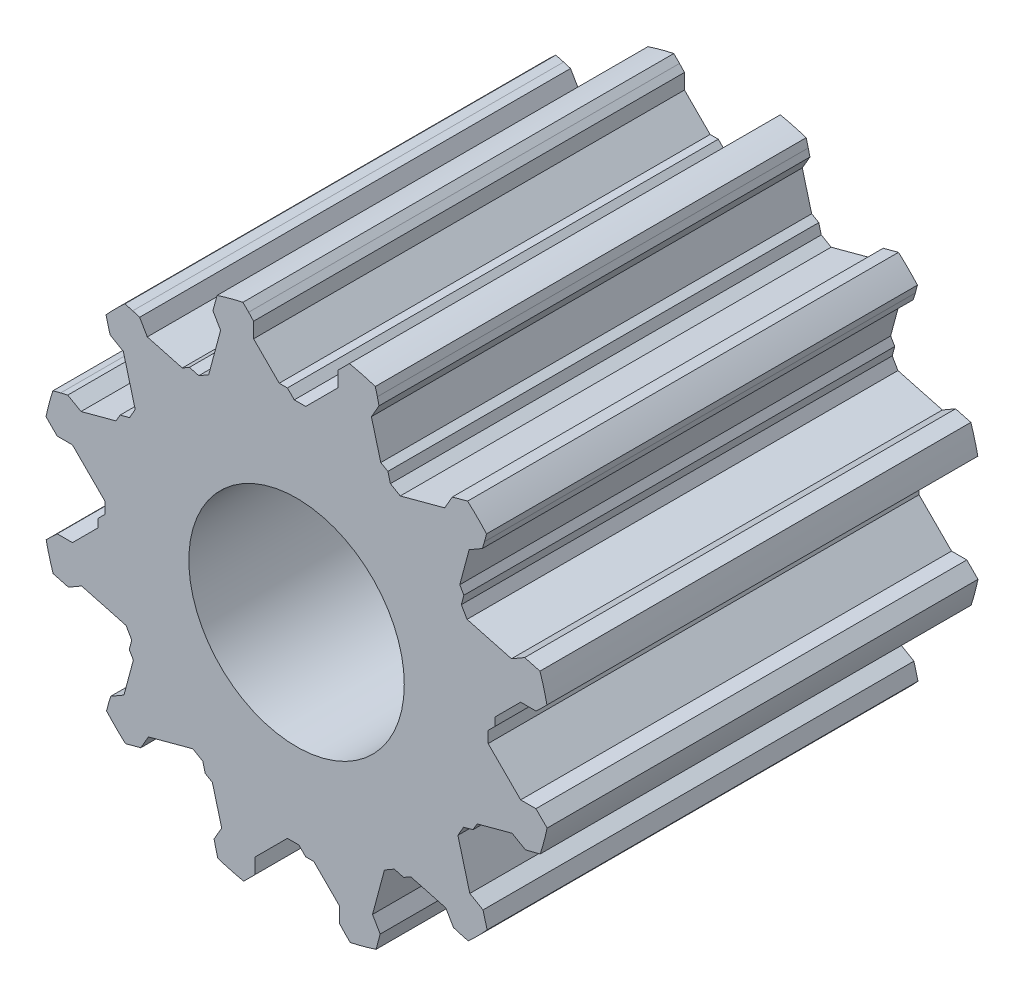
from build123d import *

# Parameters (mm, degrees)
SKETCH1_R           = 3.565718634
SKETCH1_R_2         = 1.5
BOSS_EXTRUDE1_DEPTH = 6
CUT_EXTRUDE2_DEPTH  = 6.2
CIRPATTERN1_COUNT   = 12


with BuildPart() as part:
    # Sketch1 → Boss-Extrude1 (new body)
    with BuildSketch(Plane.XY):
        Circle(SKETCH1_R)
        Circle(SKETCH1_R_2, mode=Mode.SUBTRACT)
    extrude(amount=BOSS_EXTRUDE1_DEPTH)

    # Sketch2 → Cut-Extrude2 (cut)
    with BuildSketch(Plane.XY):
        Polygon((3.963659969, 0.747183), (3.486555168, 0.747183), (3.406845069, 0.6674729), (3.333131969, 0.598311), (3.225236969, 0.598311), (3.120582969, 0.598311), (3.023409469, 0.5011375), (2.948868969, 0.426597), (2.853618469, 0.3313465), (2.763527969, 0.241256), (2.763527969, 0.127259), (2.667729469, 0.0314605), (2.667729469, -0.127259), (2.763527969, -0.2230575), (2.853618469, -0.313148), (2.948868969, -0.4083985), (3.023409469, -0.482939), (3.120582969, -0.5801125), (3.225236969, -0.5801125), (3.333131969, -0.5801125), (3.406845069, -0.6538256), (3.488948051, -0.735928582), (3.963659969, -0.735928582), align=None)
    cut_extrude2 = extrude(amount=CUT_EXTRUDE2_DEPTH, mode=Mode.SUBTRACT)

    # CirPattern1: Cut-Extrude2 ×12 about axis
    cirpattern1_axis = Axis((0, 0, -0.3), (0, 0, 1))
    for i in range(1, CIRPATTERN1_COUNT):
        add(cut_extrude2.rotate(cirpattern1_axis, i * 360 / CIRPATTERN1_COUNT), mode=Mode.SUBTRACT)


solid = part.part
